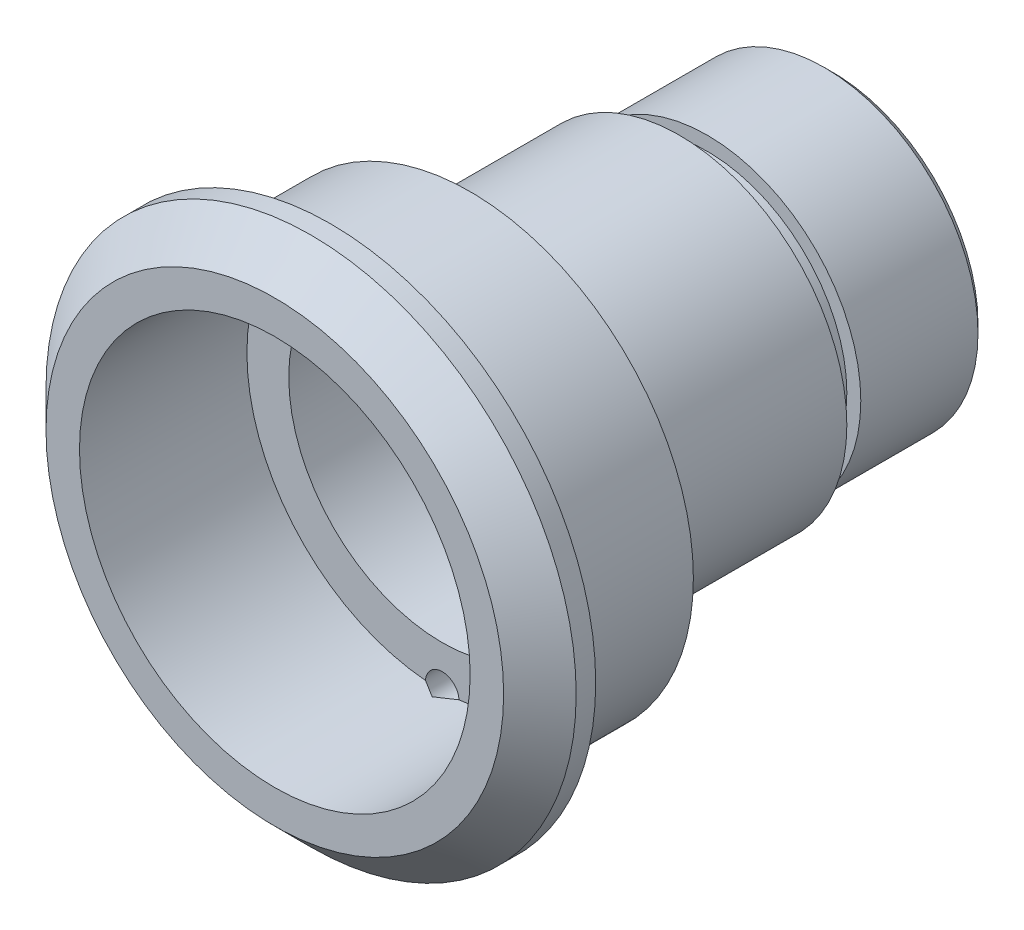
from build123d import *

# Parameters (mm, degrees)
SKETCH1_R                           = 9.5
BOSS_EXTRUDE1_DEPTH                 = 20
SKETCH2_OUTSIDE_W                   = 27.7
SKETCH2_OUTSIDE_H                   = 27.7
SKETCH2_OUTSIDE_R                   = 8
CUT_EXTRUDE1_DEPTH                  = 18
SKETCH3_OUTSIDE_W                   = 27.7
SKETCH3_OUTSIDE_H                   = 27.7
SKETCH3_OUTSIDE_R                   = 6
CUT_EXTRUDE2_DEPTH                  = 13
SKETCH4_OUTSIDE_W                   = 27.7
SKETCH4_OUTSIDE_H                   = 27.7
SKETCH4_OUTSIDE_R                   = 5.5
CUT_EXTRUDE3_DEPTH                  = 5.5
SKETCH5_W                           = 1
SKETCH5_H                           = 0.5
CHAMFER1_SIZE                       = 0.3
CHAMFER2_SIZE                       = 1.3
SKETCH7_R                           = 4.05
CUT_EXTRUDE4_DEPTH                  = 25.093567606
SKETCH8_R                           = 4.5
CUT_EXTRUDE5_DEPTH                  = 4.5
SKETCH9_R                           = 4.45
CUT_EXTRUDE9_DEPTH                  = 0.2
SKETCH10_R                          = 7
CUT_EXTRUDE11_DEPTH                 = 6
CUT_EXTRUDE12_START                 = -5.6
SKETCH11_R                          = 5.5
CUT_EXTRUDE12_DEPTH                 = 5.6
SKETCH12_R                          = 5.25
CUT_EXTRUDE13_DEPTH                 = 1.9
CHAMFER3_SIZE                       = 1.2
F_1_2_1_2_DIAMETER_HOLE1_AT_2_COUNT = 2
F_1_2_1_2_DIAMETER_HOLE1_AT_2_PITCH = 14


with BuildPart() as part:
    # Sketch1 → Boss-Extrude1 (new body)
    with BuildSketch(Plane.XY):
        Circle(SKETCH1_R)
    extrude(amount=-BOSS_EXTRUDE1_DEPTH)

    # Sketch2 outside → Cut-Extrude1 (cut)
    with BuildSketch(Plane(origin=(0, 0, -20), x_dir=(-1, 0, 0), z_dir=(0, 0, -1))):
        Rectangle(SKETCH2_OUTSIDE_W, SKETCH2_OUTSIDE_H)
        Circle(SKETCH2_OUTSIDE_R, mode=Mode.SUBTRACT)
    extrude(amount=-CUT_EXTRUDE1_DEPTH, mode=Mode.SUBTRACT)

    # Sketch3 outside → Cut-Extrude2 (cut)
    with BuildSketch(Plane(origin=(0, 0, -20), x_dir=(-1, 0, 0), z_dir=(0, 0, -1))):
        Rectangle(SKETCH3_OUTSIDE_W, SKETCH3_OUTSIDE_H)
        Circle(SKETCH3_OUTSIDE_R, mode=Mode.SUBTRACT)
    extrude(amount=-CUT_EXTRUDE2_DEPTH, mode=Mode.SUBTRACT)

    # Sketch4 outside → Cut-Extrude3 (cut)
    with BuildSketch(Plane(origin=(0, 0, -20), x_dir=(-1, 0, 0), z_dir=(0, 0, -1))):
        Rectangle(SKETCH4_OUTSIDE_W, SKETCH4_OUTSIDE_H)
        Circle(SKETCH4_OUTSIDE_R, mode=Mode.SUBTRACT)
    extrude(amount=-CUT_EXTRUDE3_DEPTH, mode=Mode.SUBTRACT)

    # Sketch5 → Cut-Revolve1 (revolve, cut)
    with BuildSketch(Plane(origin=(0, 0, 0), x_dir=(0, 0, -1), z_dir=(1, 0, 0)), mode=Mode.PRIVATE) as cut_revolve1_sk:
        with Locations((15, 5.25)):
            Rectangle(SKETCH5_W, SKETCH5_H)
    revolve(cut_revolve1_sk.sketch.rotate(Axis((0, 0, 0), (0, 0, -1)), 90), axis=Axis((0, 0, 0), (0, 0, -1)), mode=Mode.SUBTRACT)

    # Chamfer1
    chamfer1_edges = [part.edges().sort_by_distance(p)[0] for p in [
        (5.5, 0, -20),
    ]]
    chamfer(chamfer1_edges, length=CHAMFER1_SIZE)

    # Chamfer2
    chamfer2_edges = [part.edges().sort_by_distance(p)[0] for p in [
        (-9.5, 0, 0),
    ]]
    chamfer(chamfer2_edges, length=CHAMFER2_SIZE)

    # Sketch6 → Cut-Revolve2 (revolve, cut)
    with BuildSketch(Plane(origin=(0, 0, 0), x_dir=(0, 0, -1), z_dir=(1, 0, 0)), mode=Mode.PRIVATE) as cut_revolve2_sk:
        with BuildLine():
            Line((7.2, -7.033012702), (6.776794919, -6.3))
            ThreePointArc((6.776794919, -6.3), (6.776794919, -6.1), (6.95, -6))
            Line((6.95, -6), (7.2, -6))
            Line((7.2, -6), (7.2, -7.033012702))
        make_face()
    revolve(cut_revolve2_sk.sketch.rotate(Axis((0, 0, 0), (0, 0, -1)), 270), axis=Axis((0, 0, 0), (0, 0, -1)), mode=Mode.SUBTRACT)

    # Sketch7 → Cut-Extrude4 (cut, through all)
    with BuildSketch(Plane.XY):
        Circle(SKETCH7_R)
    extrude(amount=-CUT_EXTRUDE4_DEPTH, mode=Mode.SUBTRACT)

    # Sketch8 → Cut-Extrude5 (cut)
    with BuildSketch(Plane(origin=(0, 0, -20), x_dir=(-1, 0, 0), z_dir=(0, 0, -1))):
        Circle(SKETCH8_R)
    extrude(amount=-CUT_EXTRUDE5_DEPTH, mode=Mode.SUBTRACT)

    # Sketch9 → Cut-Extrude9 (cut)
    with BuildSketch(Plane(origin=(0, 0, -15.5), x_dir=(-1, 0, 0), z_dir=(0, 0, -1))):
        Circle(SKETCH9_R)
    extrude(amount=-CUT_EXTRUDE9_DEPTH, mode=Mode.SUBTRACT)

    # Sketch10 → Cut-Extrude11 (cut)
    with BuildSketch(Plane.XY):
        Circle(SKETCH10_R)
    extrude(amount=-CUT_EXTRUDE11_DEPTH, mode=Mode.SUBTRACT)

    # Sketch11 → Cut-Extrude12 (cut)
    with BuildSketch(Plane.XY.offset(-6).offset(CUT_EXTRUDE12_START)):
        Circle(SKETCH11_R)
    extrude(amount=CUT_EXTRUDE12_DEPTH, mode=Mode.SUBTRACT)

    # Sketch12 → Cut-Extrude13 (cut)
    with BuildSketch(Plane.XY.offset(-11.6)):
        Circle(SKETCH12_R)
    extrude(amount=-CUT_EXTRUDE13_DEPTH, mode=Mode.SUBTRACT)

    # Chamfer3
    chamfer3_edges = [part.edges().sort_by_distance(p)[0] for p in [
        (-4.05, 0, -13.5),
    ]]
    chamfer(chamfer3_edges, length=CHAMFER3_SIZE - 0.0001)  # a hair under: the kernel refuses the full size

    # Sketch15 → Ø1.2 (1.2) Diameter Hole1 (revolve, cut)
    with BuildSketch(Plane(origin=(0, -7, -7), x_dir=(0, 1, 0), z_dir=(1, 0, 0))):
        Polygon((0, 0), (0, 1.360516371), (0.6, 1), (0.6, 0), align=None)
    f_1_2_1_2_diameter_hole1 = revolve(axis=Axis((0, -7, -13.35), (0, 0, 1)), mode=Mode.SUBTRACT)

    # Ø1.2 (1.2) Diameter Hole1 at 2: Ø1.2 (1.2) Diameter Hole1 ×2
    with Locations(*[(0, i * F_1_2_1_2_DIAMETER_HOLE1_AT_2_PITCH, 0) for i in range(1, F_1_2_1_2_DIAMETER_HOLE1_AT_2_COUNT)]):
        add(f_1_2_1_2_diameter_hole1, mode=Mode.SUBTRACT)


solid = part.part
